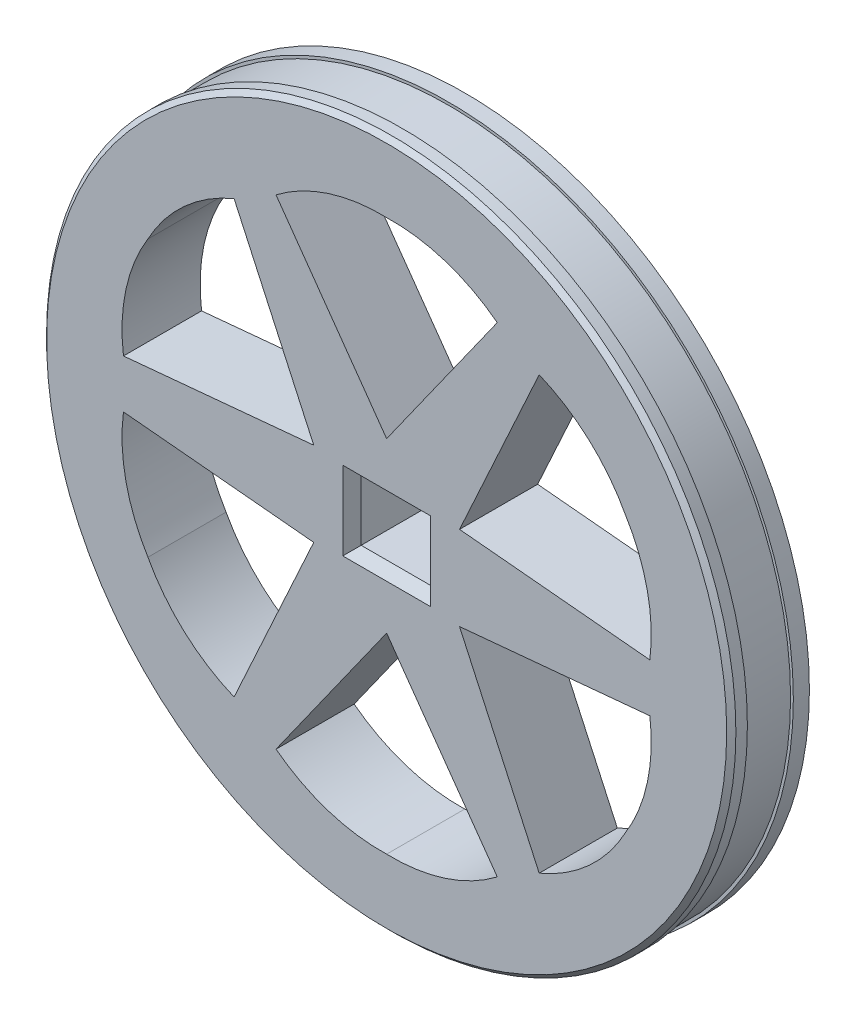
from build123d import *

# Parameters (mm, degrees)
SKETCH1_R           = 37.5
SKETCH1_W           = 8.55
SKETCH1_H           = 7.55
BOSS_EXTRUDE1_DEPTH = 4.25
CUT_EXTRUDE1_DEPTH  = 54.203030929
CIRPATTERN1_COUNT   = 6
SKETCH3_R           = 37.5
SKETCH3_R_2         = 37.2
CUT_EXTRUDE2_DEPTH  = 2.5
CHAMFER1_SIZE       = 0.5
CHAMFER1_SIZE2      = 1.5
CHAMFER2_SIZE       = 0.5


with BuildPart() as part:
    # Sketch1 → Boss-Extrude1 (new, symmetric)
    with BuildSketch(Plane.XY):
        Circle(SKETCH1_R)
        Rectangle(SKETCH1_W, SKETCH1_H, mode=Mode.SUBTRACT)
    extrude(amount=BOSS_EXTRUDE1_DEPTH, both=True)

    # Sketch2 → Cut-Extrude1 (cut, symmetric)
    with BuildSketch(Plane.XY):
        with BuildLine():
            Line((0, 9.158641407), (-12.037071564, 26.115211784))
            ThreePointArc((-12.037071564, 26.115211784), (-6.351662121, 29.087034336), (0, 29.988143709))
            ThreePointArc((0, 29.988143709), (6.351662121, 29.087034336), (12.037071564, 26.115211784))
            Line((12.037071564, 26.115211784), (0, 9.158641407))
        make_face()
    cut_extrude1 = extrude(amount=CUT_EXTRUDE1_DEPTH, both=True, mode=Mode.SUBTRACT)

    # CirPattern1: Cut-Extrude1 ×6 about axis
    cirpattern1_axis = Axis((0, 0, 4.25), (0, 0, -1))
    for i in range(1, CIRPATTERN1_COUNT):
        add(cut_extrude1.rotate(cirpattern1_axis, i * 360 / CIRPATTERN1_COUNT), mode=Mode.SUBTRACT)

    # Sketch3 → Cut-Extrude2 (cut, symmetric)
    with BuildSketch(Plane.XY):
        Circle(SKETCH3_R)
        Circle(SKETCH3_R_2, mode=Mode.SUBTRACT)
    extrude(amount=CUT_EXTRUDE2_DEPTH, both=True, mode=Mode.SUBTRACT)

    # Chamfer1
    chamfer1_edges = [part.edges().sort_by_distance(p)[0] for p in [
        (4.275, 0, 4.25),
        (0, 3.775, 4.25),
        (-4.275, 0, 4.25),
        (0, -3.775, 4.25),
    ]]
    chamfer1_side = [part.faces().sort_by_distance(p)[0] for p in [
        (-36.439339828, 0, 4.25),
    ]]
    chamfer(chamfer1_edges, length=CHAMFER1_SIZE, length2=CHAMFER1_SIZE2, reference=chamfer1_side[0])

    # Chamfer2
    chamfer2_edges = [part.edges().sort_by_distance(p)[0] for p in [
        (-37.5, 0, 4.25),
    ]]
    chamfer(chamfer2_edges, length=CHAMFER2_SIZE)


solid = part.part
